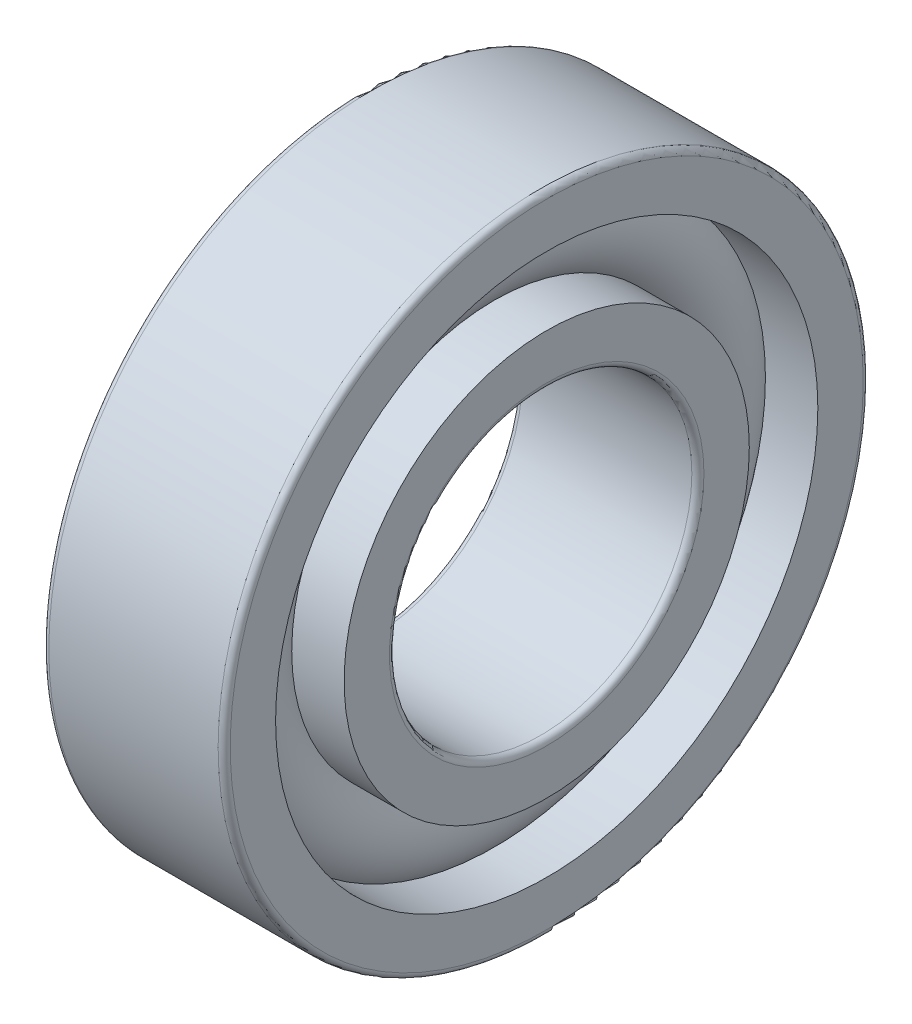
from build123d import *

# Parameters (mm, degrees)
CAGSPISKE_W     = 0.51
CAGSPISKE_H     = 0.85
CAGESPINE_ANGLE = 0.001
BALSIMSKE_R     = 2.55


with BuildPart() as part:
    # CagSpiSke → CageSpine (revolve)
    with BuildSketch(Plane.XY):
        with Locations((0, 11.75)):
            Rectangle(CAGSPISKE_W, CAGSPISKE_H)
    revolve(axis=Axis((-20.6375, 0, 0), (-1, 0, 0)), revolution_arc=CAGESPINE_ANGLE)

    # BalSimSke → BallsSimplified (revolve)
    with BuildSketch(Plane.XY):
        with Locations((0, 11.75)):
            Circle(BALSIMSKE_R)
    revolve(axis=Axis((-10, 0, 0), (1, 0, 0)))

    # InnRacSke → InnerRace (revolve)
    with BuildSketch(Plane.XY):
        with BuildLine():
            Line((-1.86698286, 10.05), (-4.5, 10.05))
            Line((-4.5, 10.05), (-4.5, 7.8))
            ThreePointArc((-4.5, 7.8), (-4.412132034, 7.587867966), (-4.2, 7.5))
            Line((-4.2, 7.5), (4.2, 7.5))
            ThreePointArc((4.2, 7.5), (4.412132034, 7.587867966), (4.5, 7.8))
            Line((4.5, 7.8), (4.5, 10.05))
            Line((4.5, 10.05), (1.86698286, 10.05))
            ThreePointArc((1.86698286, 10.05), (0, 9.225), (-1.86698286, 10.05))
        make_face()
    revolve(axis=Axis((-20.6375, 0, 0), (1, 0, 0)))

    # OutRacSke → OuterRace (revolve)
    with BuildSketch(Plane.XY):
        with BuildLine():
            Line((-1.86698286, 13.45), (-4.5, 13.45))
            Line((-4.5, 13.45), (-4.5, 15.7))
            ThreePointArc((-4.5, 15.7), (-4.412132034, 15.912132034), (-4.2, 16))
            Line((-4.2, 16), (4.2, 16))
            ThreePointArc((4.2, 16), (4.412132034, 15.912132034), (4.5, 15.7))
            Line((4.5, 15.7), (4.5, 13.45))
            Line((4.5, 13.45), (1.86698286, 13.45))
            ThreePointArc((1.86698286, 13.45), (0, 14.275), (-1.86698286, 13.45))
        make_face()
    revolve(axis=Axis((-20.6375, 0, 0), (1, 0, 0)))


solid = part.part
